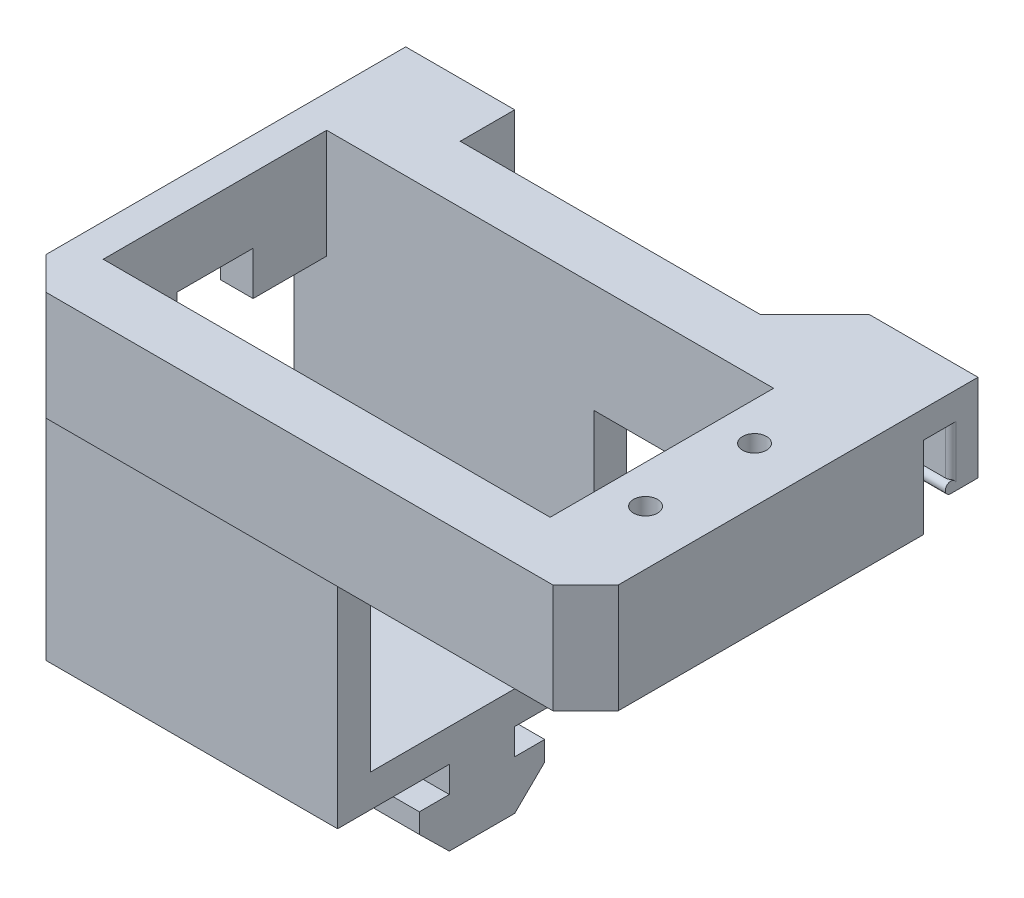
from build123d import *

# Parameters (mm, degrees)
CROQUIS1_W              = 58
CROQUIS1_H              = 31
CROQUIS1_R              = 1.1
CROQUIS1_W_2            = 41
CROQUIS1_H_2            = 20.5
SALIENTE_EXTRUIR1_DEPTH = 10
SALIENTE_EXTRUIR2_DEPTH = 33
CROQUIS3_R              = 2.1
CORTAR_EXTRUIR1_DEPTH   = 50.740551867
CROQUIS4_W              = 20.5
CROQUIS4_H              = 18.5
CORTAR_EXTRUIR2_DEPTH   = 5.5
CHAFL_N1_SIZE           = 1.5
CHAFL_N2_SIZE           = 2
CROQUIS5_W              = 3
CROQUIS5_H              = 20.5
SALIENTE_EXTRUIR3_DEPTH = 10
CORTAR_EXTRUIR3_REACH   = 63.669
CROQUIS6_W              = 7
CROQUIS6_H              = 4
CROQUIS7_W              = 4
CROQUIS7_H              = 6
SALIENTE_EXTRUIR4_DEPTH = 0.5
CHAFL_N3_SIZE           = 3
SALIENTE_EXTRUIR5_DEPTH = 10
REDONDEO1_R             = 0.5
SALIENTE_EXTRUIR6_START = -10
SALIENTE_EXTRUIR6_DEPTH = 10
CHAFL_N5_SIZE           = 0.5
CHAFL_N6_SIZE           = 5


with BuildPart() as part:
    # Croquis1 → Saliente-Extruir1 (new body)
    with BuildSketch(Plane(origin=(0, 0, 0), x_dir=(1, 0, 0), z_dir=(0, 1, 0))):
        Rectangle(CROQUIS1_W, CROQUIS1_H)
        with Locations(Location((-24, -5, 0), (0, 0, 270))):
            Circle(CROQUIS1_R, mode=Mode.SUBTRACT)
        with Locations(Location((24, -5, 0), (0, 0, 270))):
            Circle(CROQUIS1_R, mode=Mode.SUBTRACT)
        with Locations(Location((24, 5, 0), (0, 0, 270))):
            Circle(CROQUIS1_R, mode=Mode.SUBTRACT)
        with Locations(Location((-24, 5, 0), (0, 0, 270))):
            Circle(CROQUIS1_R, mode=Mode.SUBTRACT)
        Rectangle(CROQUIS1_W_2, CROQUIS1_H_2, mode=Mode.SUBTRACT)
    extrude(amount=SALIENTE_EXTRUIR1_DEPTH)

    # Croquis2 → Saliente-Extruir2 (add)
    with BuildSketch(Plane.ZY.offset(29)):
        Polygon((10.25, -18.5), (-10.25, -18.5), (-10.25, 0), (-13.25, 0), (-13.25, -21.5), (-3, -21.5), (-3, -23.9), (-5.75, -23.9), (-5.75, -25.7), (-3, -28.4), (3, -28.4), (5.75, -25.7), (5.75, -23.9), (3, -23.9), (3, -21.5), (13.25, -21.5), (13.25, 0), (10.25, 0), align=None)
    extrude(amount=-SALIENTE_EXTRUIR2_DEPTH)

    # Croquis3 → Cortar-Extruir1 (cut, through all)
    with BuildSketch(Plane.XY.offset(13.25)):
        with Locations((-9.737832968, -26.4)):
            Circle(CROQUIS3_R)
    extrude(amount=-CORTAR_EXTRUIR1_DEPTH, mode=Mode.SUBTRACT)

    # Croquis4 → Cortar-Extruir2 (cut)
    with BuildSketch(Plane.ZY.offset(29)):
        Polygon((-15.5, 0), (-13.25, 0), (-13.25, -21.5), (-3, -21.5), (-3, -23.9), (-5.75, -23.9), (-5.75, -25.7), (-3, -28.4), (3, -28.4), (5.75, -25.7), (5.75, -23.9), (3, -23.9), (3, -21.5), (13.25, -21.5), (13.25, 0), (15.5, 0), (15.5, 10), (-15.5, 10), align=None)
        with Locations((0, -9.25)):
            Rectangle(CROQUIS4_W, CROQUIS4_H, mode=Mode.SUBTRACT)
    extrude(amount=-CORTAR_EXTRUIR2_DEPTH, mode=Mode.SUBTRACT)

    # Chaflán1
    chafl_n1_edges = [part.edges().sort_by_distance(p)[0] for p in [
        (-23.5, -18.5, 0),
    ]]
    chamfer(chafl_n1_edges, length=CHAFL_N1_SIZE)

    # Chaflán2
    chafl_n2_edges = [part.edges().sort_by_distance(p)[0] for p in [
        (-9.75, 0, -13.25),
        (-9.75, 0, 13.25),
    ]]
    chamfer(chafl_n2_edges, length=CHAFL_N2_SIZE)

    # Croquis5 → Saliente-Extruir3 (add)
    with BuildSketch(Plane.XZ):
        with Locations((-22, 0)):
            Rectangle(CROQUIS5_W, CROQUIS5_H)
    extrude(amount=-SALIENTE_EXTRUIR3_DEPTH)

    # Croquis6 → Cortar-Extruir3 (cut, up to next)
    with BuildSketch(Plane.ZY.offset(23.5), mode=Mode.PRIVATE) as cortar_extruir3_sk1:
        with Locations((0, 2)):
            Rectangle(CROQUIS6_W, CROQUIS6_H)
    cortar_extruir3_tool1 = extrude(cortar_extruir3_sk1.sketch, amount=-CORTAR_EXTRUIR3_REACH, mode=Mode.PRIVATE) & part.part
    add(cortar_extruir3_tool1.solids().sort_by_distance((-23.5, 2, 0))[0], mode=Mode.SUBTRACT)

    # Croquis7 → Saliente-Extruir4 (add)
    with BuildSketch(Plane.XZ.offset(28.4)):
        with Locations((-9.737832968, 0)):
            Rectangle(CROQUIS7_W, CROQUIS7_H)
    extrude(amount=-SALIENTE_EXTRUIR4_DEPTH)

    # Chaflán3
    chafl_n3_edges = [part.edges().sort_by_distance(p)[0] for p in [
        (-23.5, 5, 15.5),
        (29, 5, 15.5),
    ]]
    chamfer(chafl_n3_edges, length=CHAFL_N3_SIZE)

    # Croquis8 → Saliente-Extruir5 (add)
    with BuildSketch(Plane(origin=(29, 0, 0), x_dir=(0, 0, -1), z_dir=(1, 0, 0))):
        with BuildLine():
            Line((18, 7.5), (18, 3))
            ThreePointArc((18, 3), (17.5, 2.5), (18, 2))
            Line((18, 2), (20.5, 2))
            Line((20.5, 2), (20.5, 10))
            Line((20.5, 10), (15.5, 10))
            Line((15.5, 10), (15.5, 7.5))
            Line((15.5, 7.5), (18, 7.5))
        make_face()
    extrude(amount=-SALIENTE_EXTRUIR5_DEPTH)

    # Redondeo1
    redondeo1_edges = [part.edges().sort_by_distance(p)[0] for p in [
        (29, 5.25, -18),
    ]]
    fillet(redondeo1_edges, radius=REDONDEO1_R - 0.0001)  # a hair under: the kernel refuses the full size

    # Croquis9 → Saliente-Extruir6 (add)
    with BuildSketch(Plane.ZY.offset(23.5).offset(SALIENTE_EXTRUIR6_START)):
        with BuildLine():
            Line((-18, 3), (-18, 7.5))
            Line((-18, 7.5), (-15.5, 7.5))
            Line((-15.5, 7.5), (-15.5, 10))
            Line((-15.5, 10), (-20.5, 10))
            Line((-20.5, 10), (-20.5, 2))
            Line((-20.5, 2), (-18, 2))
            ThreePointArc((-18, 2), (-17.5, 2.5), (-18, 3))
        make_face()
    extrude(amount=SALIENTE_EXTRUIR6_DEPTH)

    # Chaflán5
    chafl_n5_edges = [part.edges().sort_by_distance(p)[0] for p in [
        (-23.5, 3.75, -15.5),
        (-23.5, 5.25, -18),
    ]]
    chamfer(chafl_n5_edges, length=CHAFL_N5_SIZE - 0.0001)  # a hair under: the kernel refuses the full size

    # Chaflán6
    chafl_n6_edges = [part.edges().sort_by_distance(p)[0] for p in [
        (19, 8.75, -15.5),
    ]]
    chamfer(chafl_n6_edges, length=CHAFL_N6_SIZE - 0.0001)  # a hair under: the kernel refuses the full size


solid = part.part
